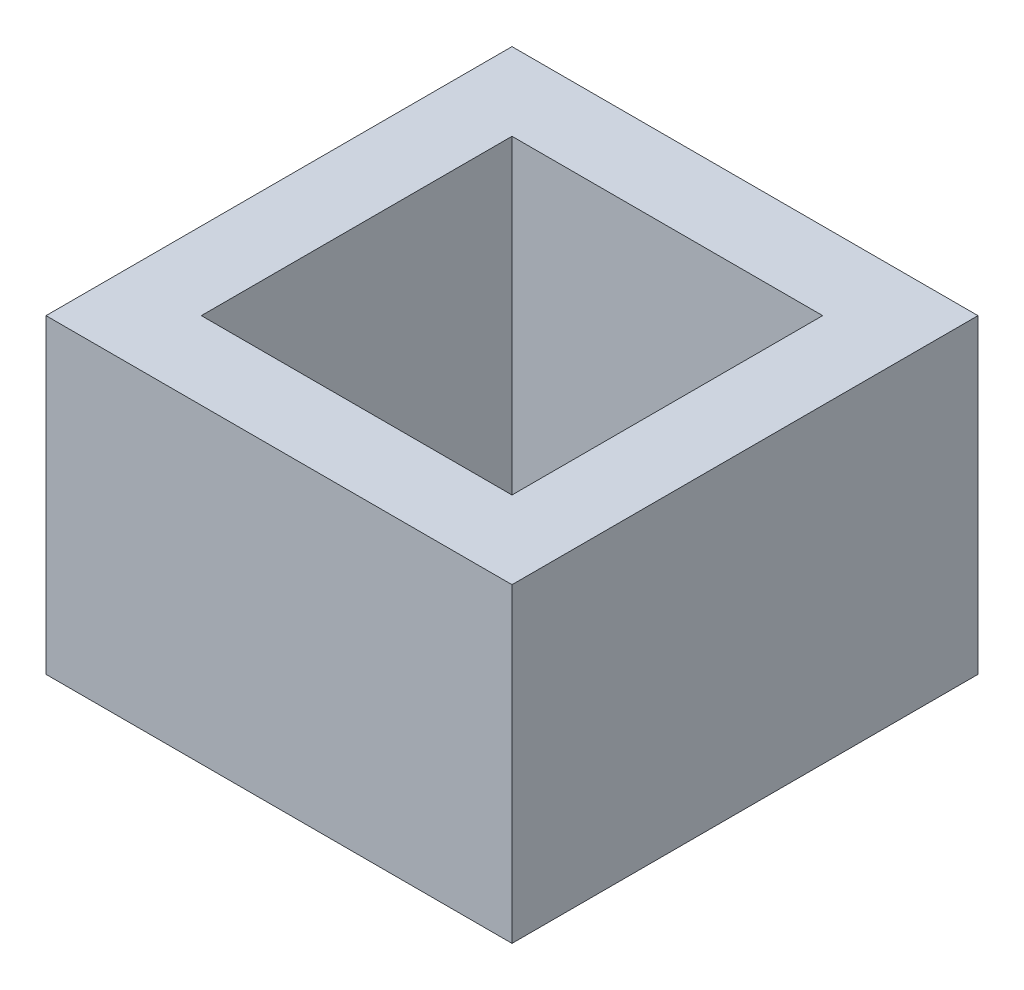
from build123d import *

# Parameters (mm, degrees)
SKETCH1_W           = 30
SKETCH1_H           = 30
SKETCH1_W_2         = 20
SKETCH1_H_2         = 20
BOSS_EXTRUDE1_DEPTH = 20


with BuildPart() as part:
    # Sketch1 → Boss-Extrude1 (new body)
    with BuildSketch(Plane(origin=(0, 0, 0), x_dir=(1, 0, 0), z_dir=(0, 1, 0))):
        Rectangle(SKETCH1_W, SKETCH1_H)
        Rectangle(SKETCH1_W_2, SKETCH1_H_2, mode=Mode.SUBTRACT)
    extrude(amount=BOSS_EXTRUDE1_DEPTH)


solid = part.part
